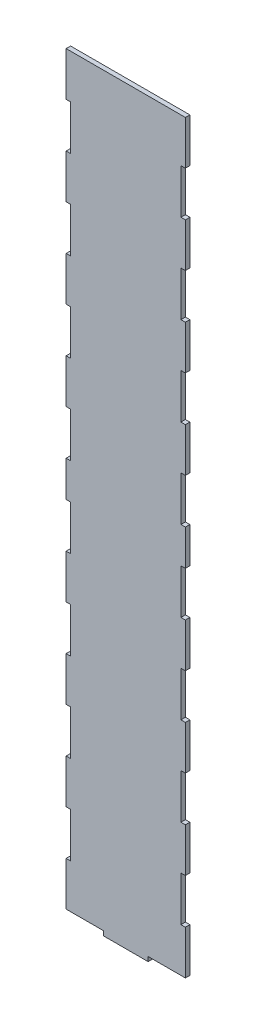
from build123d import *

# Parameters (mm, degrees)
RESSALTO_EXTRUS_O1_DEPTH = 3
ESBO_O2_W                = 3
ESBO_O2_H                = 30
CORTE_EXTRUS_O1_DEPTH    = 257.160106184


with BuildPart() as part:
    # Esboço1 → Ressalto-extrusão1 (new body)
    with BuildSketch(Plane.XY):
        Polygon((15, -250), (40, -250), (40, 250), (-40, 250), (-40, -250), (-15, -250), (-15, -253), (15, -253), align=None)
    extrude(amount=RESSALTO_EXTRUS_O1_DEPTH)

    # Esboço2 → Corte-extrusão1 (cut, through all)
    with BuildSketch(Plane.XY.offset(3)):
        with Locations((-38.5, 205.5)):
            Rectangle(ESBO_O2_W, ESBO_O2_H)
        with Locations((-38.5, 86.5)):
            Rectangle(ESBO_O2_W, ESBO_O2_H)
        with Locations((-38.5, 146)):
            Rectangle(ESBO_O2_W, ESBO_O2_H)
        with Locations((-38.5, 27)):
            Rectangle(ESBO_O2_W, ESBO_O2_H)
        with Locations((-38.5, -205.5)):
            Rectangle(ESBO_O2_W, ESBO_O2_H)
        with Locations((-38.5, -146)):
            Rectangle(ESBO_O2_W, ESBO_O2_H)
        with Locations((-38.5, -86.5)):
            Rectangle(ESBO_O2_W, ESBO_O2_H)
        with Locations((-38.5, -27)):
            Rectangle(ESBO_O2_W, ESBO_O2_H)
        with Locations((38.5, -205.5)):
            Rectangle(ESBO_O2_W, ESBO_O2_H)
        with Locations((38.5, -146)):
            Rectangle(ESBO_O2_W, ESBO_O2_H)
        with Locations((38.5, -86.5)):
            Rectangle(ESBO_O2_W, ESBO_O2_H)
        with Locations((38.5, -27)):
            Rectangle(ESBO_O2_W, ESBO_O2_H)
        with Locations((38.5, 27)):
            Rectangle(ESBO_O2_W, ESBO_O2_H)
        with Locations((38.5, 86.5)):
            Rectangle(ESBO_O2_W, ESBO_O2_H)
        with Locations((38.5, 146)):
            Rectangle(ESBO_O2_W, ESBO_O2_H)
        with Locations((38.5, 205.5)):
            Rectangle(ESBO_O2_W, ESBO_O2_H)
    extrude(amount=-CORTE_EXTRUS_O1_DEPTH, mode=Mode.SUBTRACT)


solid = part.part
